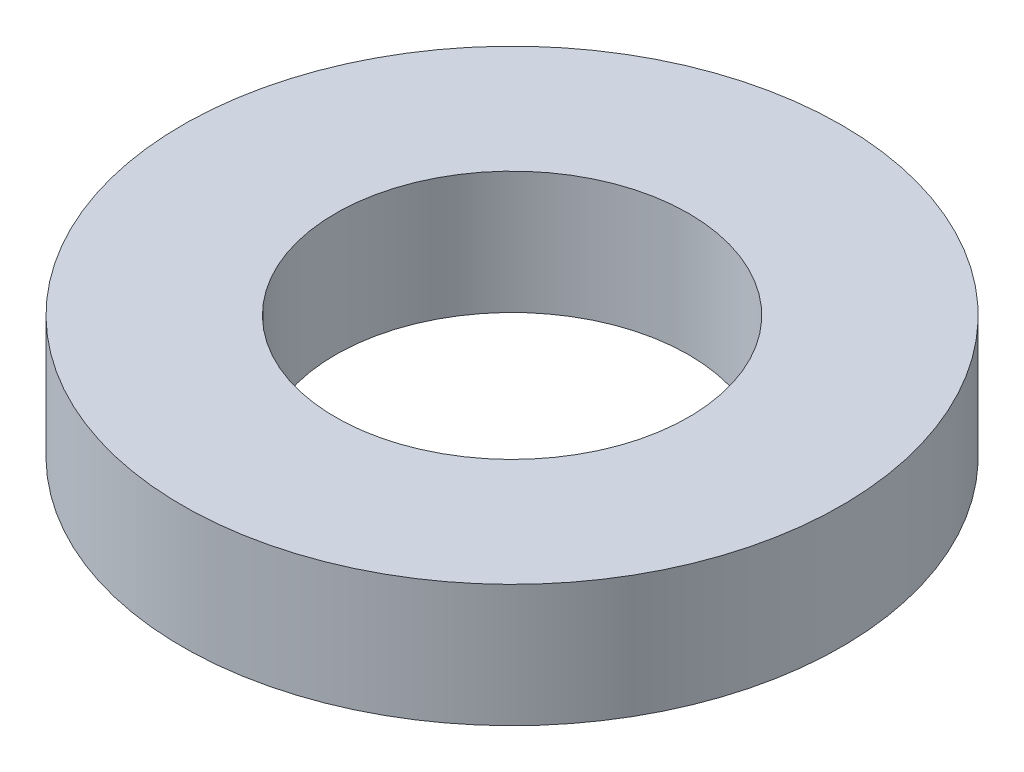
from build123d import *

# Parameters (mm, degrees)
SKETCH1_R           = 70
BOSS_EXTRUDE1_DEPTH = 26
SKETCH2_R           = 37.5
CUT_EXTRUDE1_DEPTH  = 103.352332655


with BuildPart() as part:
    # Sketch1 → Boss-Extrude1 (new body)
    with BuildSketch(Plane(origin=(0, 0, 0), x_dir=(1, 0, 0), z_dir=(0, 1, 0))):
        Circle(SKETCH1_R)
    extrude(amount=BOSS_EXTRUDE1_DEPTH)

    # Sketch2 → Cut-Extrude1 (cut, through all)
    with BuildSketch(Plane(origin=(0, 0, 0), x_dir=(1, 0, 0), z_dir=(0, 1, 0))):
        Circle(SKETCH2_R)
    extrude(amount=CUT_EXTRUDE1_DEPTH, mode=Mode.SUBTRACT)


solid = part.part
